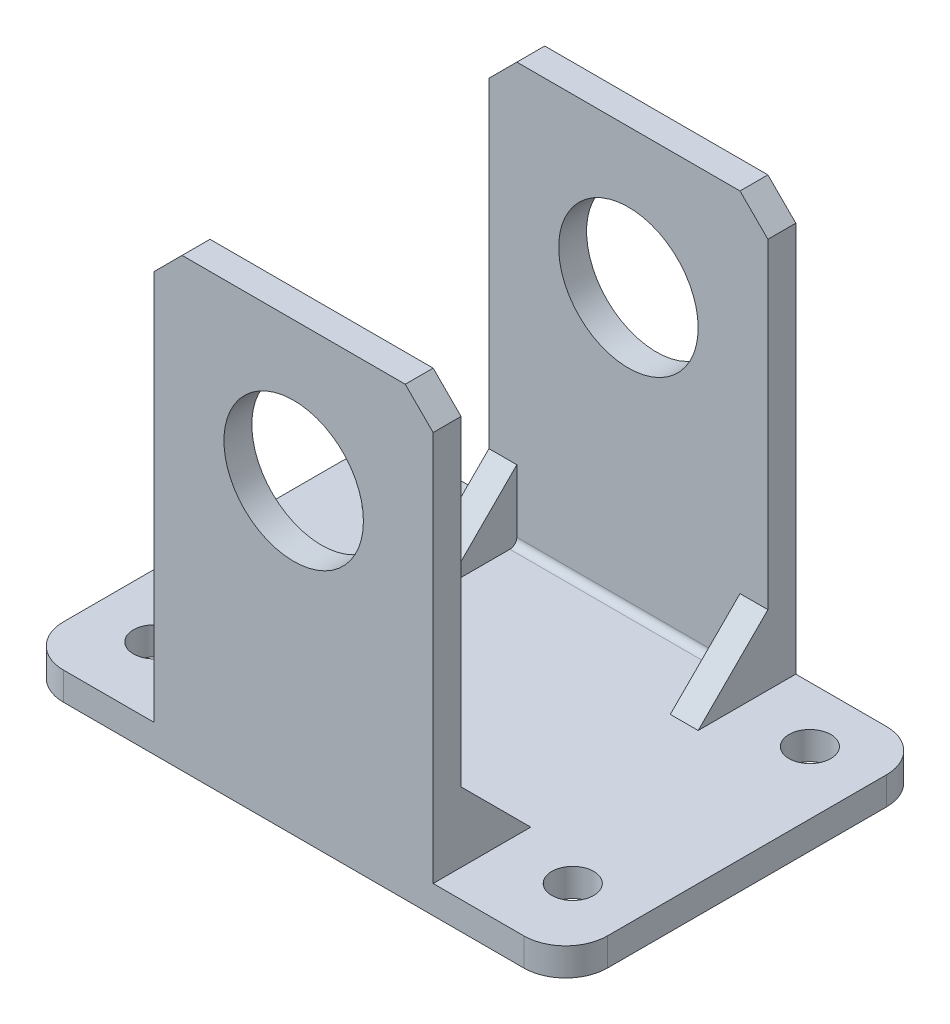
from build123d import *

# Parameters (mm, degrees)
SKETCH1_W            = 20
SKETCH1_H            = 26
BOSS_EXTRUDE1_DEPTH  = 2
SKETCH2_W            = 20
SKETCH2_H            = 2
BOSS_EXTRUDE2_DEPTH  = 30
SKETCH3_R            = 5
CUT_EXTRUDE1_DEPTH   = 43.426406871
SKETCH4_W            = 39
SKETCH4_H            = 26
BOSS_EXTRUDE3_DEPTH  = 2
SKETCH5_R            = 1.5
CUT_EXTRUDE2_DEPTH   = 39.069016273
FILLET1_R            = 3
CHAMFER1_SIZE        = 2
RIB3_START           = -2
RIB3_DEPTH           = 2
MIRROR2_START        = -2
MIRROR2_COPY_1_DEPTH = 2
FILLET2_R            = 0.5


# Read off the part's stored shape, not the designer's step: Rib3
with BuildPart() as part:
    # Sketch1 → Boss-Extrude1 (new body)
    with BuildSketch(Plane(origin=(0, 0, 0), x_dir=(1, 0, 0), z_dir=(0, 1, 0))):
        Rectangle(SKETCH1_W, SKETCH1_H)
    extrude(amount=BOSS_EXTRUDE1_DEPTH)

    # Sketch2 → Boss-Extrude2 (add)
    with BuildSketch(Plane(origin=(0, 2, 0), x_dir=(1, 0, 0), z_dir=(0, 1, 0))):
        with Locations((0, -12)):
            Rectangle(SKETCH2_W, SKETCH2_H)
        with Locations((0, 12)):
            Rectangle(SKETCH2_W, SKETCH2_H)
    extrude(amount=BOSS_EXTRUDE2_DEPTH)

    # Sketch3 → Cut-Extrude1 (cut, through all)
    with BuildSketch(Plane.XY.offset(13)):
        with Locations((0, 22)):
            Circle(SKETCH3_R)
    extrude(amount=-CUT_EXTRUDE1_DEPTH, mode=Mode.SUBTRACT)

    # Sketch4 → Boss-Extrude3 (add)
    with BuildSketch(Plane(origin=(0, 2, 0), x_dir=(1, 0, 0), z_dir=(0, 1, 0))):
        Rectangle(SKETCH4_W, SKETCH4_H)
    extrude(amount=-BOSS_EXTRUDE3_DEPTH)

    # Sketch5 → Cut-Extrude2 (cut, through all)
    with BuildSketch(Plane(origin=(0, 2, 0), x_dir=(1, 0, 0), z_dir=(0, 1, 0))):
        with Locations(Location((-15, 9.01, 0), (0, 0, 270))):
            Circle(SKETCH5_R)
        with Locations(Location((-15, -7.99, 0), (0, 0, 270))):
            Circle(SKETCH5_R)
        with Locations(Location((15, -7.99, 0), (0, 0, 270))):
            Circle(SKETCH5_R)
        with Locations(Location((15, 9.01, 0), (0, 0, 270))):
            Circle(SKETCH5_R)
    extrude(amount=-CUT_EXTRUDE2_DEPTH, mode=Mode.SUBTRACT)

    # Fillet1
    fillet1_edges = [part.edges().sort_by_distance(p)[0] for p in [
        (-19.5, 1, -13),
        (19.5, 1, 13),
        (-19.5, 1, 13),
        (19.5, 1, -13),
    ]]
    fillet(fillet1_edges, radius=FILLET1_R)

    # Chamfer1
    chamfer1_edges = [part.edges().sort_by_distance(p)[0] for p in [
        (10, 32, 12),
        (-10, 32, 12),
        (-10, 32, -12),
        (10, 32, -12),
    ]]
    chamfer(chamfer1_edges, length=CHAMFER1_SIZE)

    # Rib3 outline → Rib3 (add)
    with BuildSketch(Plane(origin=(10, 0, 0), x_dir=(0, 0, -1), z_dir=(1, 0, 0)).offset(RIB3_START)):
        Polygon((11, 2), (11, 7), (6, 2), align=None)
    rib3 = extrude(amount=RIB3_DEPTH)

    # Mirror1: Rib3 across plane
    add(rib3.mirror(Plane.XY))

    # Mirror2: Rib3 across plane
    add(rib3.mirror(Plane(origin=(0, 0, 0), x_dir=(0, 0, 1), z_dir=(1, 0, 0))))

    # Mirror2 copy 1 sketch → Mirror2 copy 1 (add)
    with BuildSketch(Plane.ZY.offset(10).offset(MIRROR2_START)):
        Polygon((11, 2), (11, 7), (6, 2), align=None)
    extrude(amount=MIRROR2_COPY_1_DEPTH)

    # Fillet2
    fillet2_edges = [part.edges().sort_by_distance(p)[0] for p in [
        (0, 2, 11),
        (0, 2, -11),
    ]]
    fillet(fillet2_edges, radius=FILLET2_R)


solid = part.part
